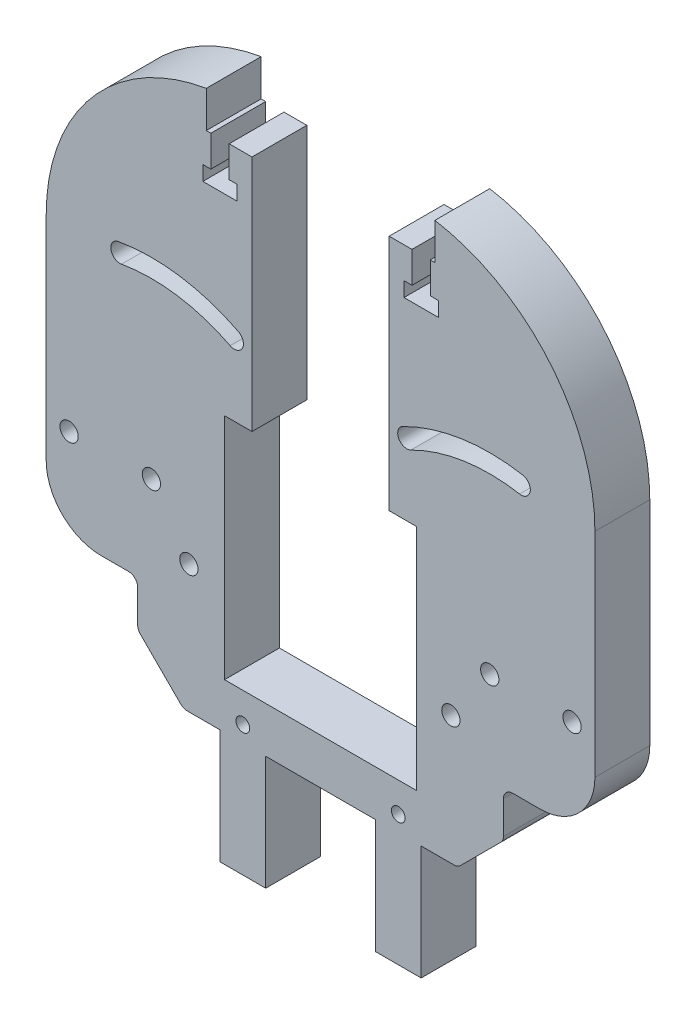
from build123d import *

# Parameters (mm, degrees)
BOSS_EXTRUDE1_DEPTH = 12
SKETCH2_R           = 2
SKETCH2_R_2         = 1.5
CUT_EXTRUDE1_DEPTH  = 95.704804524
SKETCH4_W           = 20
SKETCH4_H           = 100
BOSS_EXTRUDE2_DEPTH = 12
FILLET3_R           = 42
FILLET4_R           = 12
SKETCH7_R           = 2
CUT_EXTRUDE3_DEPTH  = 105.732993846
CHAMFER1_SIZE       = 10
FILLET8_R           = 2
CUT_EXTRUDE4_DEPTH  = 105.732993846
CUT_EXTRUDE5_DEPTH  = 105.732993846


with BuildPart() as part:
    # Sketch1 → Boss-Extrude1 (new body)
    with BuildSketch(Plane.XY):
        Polygon((-40, 60), (-25, 60), (-25, 52), (-15, 52), (-15, 0), (-21, 0), (-21, -50), (21, -50), (21, 0), (15, 0), (15, 52), (25, 52), (25, 60), (40, 60), (40, -60), (22, -60), (22, -85), (12, -85), (12, -60), (-12, -60), (-12, -85), (-22, -85), (-22, -60), (-40, -60), align=None)
    extrude(amount=BOSS_EXTRUDE1_DEPTH)

    # Sketch2 → Cut-Extrude1 (cut, through all)
    with BuildSketch(Plane(origin=(0, 0, 0), x_dir=(-1, 0, 0), z_dir=(0, 0, -1))):
        with Locations((-28.5, -32)):
            Circle(SKETCH2_R)
        with Locations((17, -56.5)):
            Circle(SKETCH2_R_2)
        with Locations((28.8, -32)):
            Circle(SKETCH2_R)
        with Locations((-17, -56.5)):
            Circle(SKETCH2_R_2)
    extrude(amount=-CUT_EXTRUDE1_DEPTH, mode=Mode.SUBTRACT)

    # Sketch4 → Boss-Extrude2 (add)
    with BuildSketch(Plane.XY.offset(12)):
        with Locations((-50, 10)):
            Rectangle(SKETCH4_W, SKETCH4_H)
        with Locations((50, 10)):
            Rectangle(SKETCH4_W, SKETCH4_H)
    extrude(amount=-BOSS_EXTRUDE2_DEPTH)

    # Fillet3
    # the kernel refuses this fillet: 42 mm, written as the material it takes off along each edge
    with BuildSketch(Plane(origin=(60, 60, 115.531396204), x_dir=(0, -1, 0), z_dir=(0, 0, -1))) as fillet3_piece_1:
        with BuildLine():
            CenterArc((41.412558482, 42), FILLET3_R, 189.594068227, 80.405931773)
            Line((0, 35), (-0.82825117, 34.86))
            ThreePointArc((-0.82825117, 34.86), (-0.84, 17.5), (-0.84, 0))
            Line((-0.84, 0), (0, -0.84))
            Line((0, -0.84), (41.412558482, -0.84))
            Line((41.412558482, -0.84), (41.412558482, 0))
        make_face()
    extrude(amount=219.062792409, mode=Mode.SUBTRACT)
    with BuildSketch(Plane(origin=(-60, 60, 115.531396204), x_dir=(1, 0, 0), z_dir=(0, 0, -1))) as fillet3_piece_2:
        with BuildLine():
            CenterArc((42, 41.412558482), FILLET3_R, 180, 80.405931773)
            Line((0, 41.412558482), (-0.84, 41.412558482))
            Line((-0.84, 41.412558482), (-0.84, 0))
            Line((-0.84, 0), (0, -0.84))
            ThreePointArc((0, -0.84), (17.5, -0.84), (34.86, -0.82825117))
            Line((34.86, -0.82825117), (35, 0))
        make_face()
    extrude(amount=219.062792409, mode=Mode.SUBTRACT)

    # Fillet4
    fillet4_edges = [part.edges().sort_by_distance(p)[0] for p in [
        (60, -40, 6),
        (-60, -40, 6),
    ]]
    fillet(fillet4_edges, radius=FILLET4_R)

    # Sketch7 → Cut-Extrude3 (cut, through all)
    with BuildSketch(Plane.XY):
        with Locations(Location((-55, -20, 0), (0, 0, 180))):
            Circle(SKETCH7_R)
        with Locations(Location((55, -20, 0), (0, 0, 180))):
            Circle(SKETCH7_R)
        with Locations(Location((-37, -20, 0), (0, 0, 180))):
            Circle(SKETCH7_R)
        with Locations(Location((37, -20, 0), (0, 0, 180))):
            Circle(SKETCH7_R)
    extrude(amount=CUT_EXTRUDE3_DEPTH, mode=Mode.SUBTRACT)

    # Chamfer1
    chamfer1_edges = [part.edges().sort_by_distance(p)[0] for p in [
        (-40, -60, 6),
        (40, -60, 6),
    ]]
    chamfer(chamfer1_edges, length=CHAMFER1_SIZE)

    # Fillet8
    fillet8_edges = [part.edges().sort_by_distance(p)[0] for p in [
        (-30, -60, 6),
        (-40, -50, 6),
        (30, -60, 6),
        (40, -50, 6),
        (40, -40, 6),
        (-40, -40, 6),
    ]]
    fillet(fillet8_edges, radius=FILLET8_R)

    # Sketch8 → Cut-Extrude4 (cut, through all)
    with BuildSketch(Plane(origin=(0, 0, 0), x_dir=(-1, 0, 0), z_dir=(0, 0, -1))):
        with BuildLine():
            ThreePointArc((-17.964817996, 17.438774634), (-30.770630407, 21.535466224), (-44.214817996, 21.375674028))
            ThreePointArc((-44.214817996, 21.375674028), (-45.841525426, 19.061841075), (-43.527692473, 17.435133644))
            ThreePointArc((-43.527692473, 17.435133644), (-31.363903701, 17.579707536), (-19.777692473, 13.87317705))
            ThreePointArc((-19.777692473, 13.87317705), (-17.088456442, 14.749538603), (-17.964817996, 17.438774634))
        make_face()
        with BuildLine():
            ThreePointArc((17.964817996, 17.438774634), (30.770630407, 21.535466224), (44.214817996, 21.375674028))
            ThreePointArc((44.214817996, 21.375674028), (45.841525426, 19.061841075), (43.527692473, 17.435133644))
            ThreePointArc((43.527692473, 17.435133644), (31.363903701, 17.579707536), (19.777692473, 13.87317705))
            ThreePointArc((19.777692473, 13.87317705), (17.088456442, 14.749538603), (17.964817996, 17.438774634))
        make_face()
    extrude(amount=-CUT_EXTRUDE4_DEPTH, mode=Mode.SUBTRACT)

    # Sketch9 → Cut-Extrude5 (cut, through all)
    with BuildSketch(Plane.XY.offset(12)):
        Polygon((-24, 52), (-20, 52), (-20, 45.2), (-18.25, 45.2), (-18.25, 42), (-25.75, 42), (-25.75, 45.2), (-24, 45.2), align=None)
    cut_extrude5 = extrude(amount=-CUT_EXTRUDE5_DEPTH, mode=Mode.SUBTRACT)

    # Mirror1: Cut-Extrude5 across plane
    add(cut_extrude5.mirror(Plane(origin=(0, 0, 0), x_dir=(0, 0, 1), z_dir=(1, 0, 0))), mode=Mode.SUBTRACT)


solid = part.part
